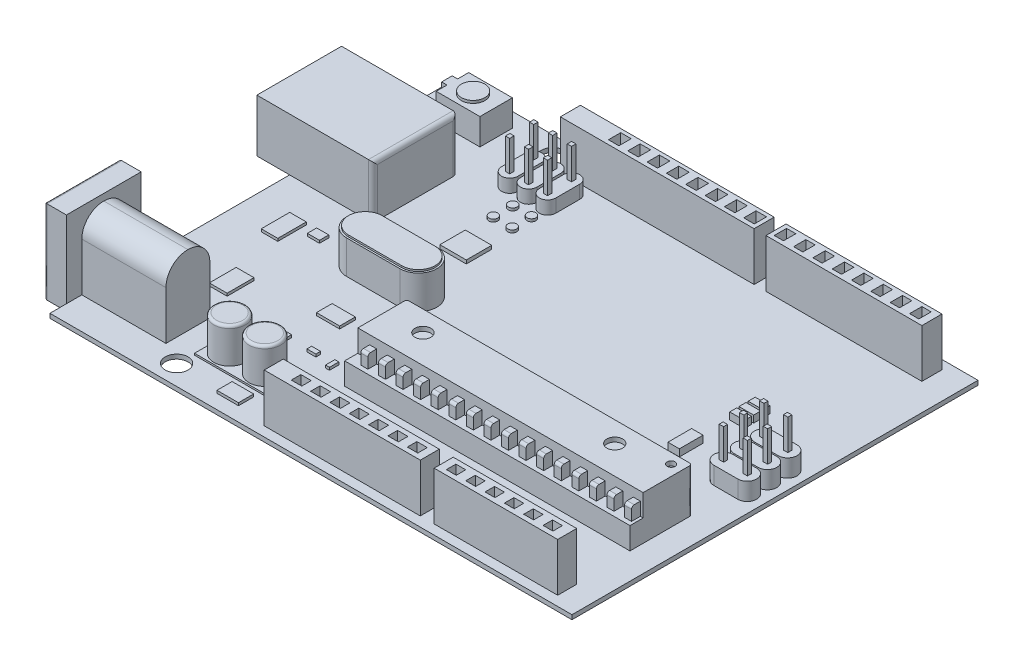
from build123d import *

# Parameters (mm, degrees)
BOSS_EXTRUDE2_DEPTH    = 55
SKETCH3_W              = 140.514955922
SKETCH3_H              = 21.639303212
BOSS_EXTRUDE3_DEPTH    = 55
CUT_EXTRUDE1_START     = 5
SKETCH4_W              = 11.850658933
SKETCH4_H              = 10.834888168
SKETCH4_W_2            = 11.204003532
CUT_EXTRUDE1_DEPTH     = 50
SKETCH5_W              = 220.455310393
SKETCH5_H              = 22.830323406
BOSS_EXTRUDE4_DEPTH    = 55
SKETCH6_W              = 177.429354246
SKETCH6_H              = 22.830323406
BOSS_EXTRUDE5_DEPTH    = 55
CUT_EXTRUDE2_START     = 5
SKETCH7_W              = 11.936344285
SKETCH7_H              = 14.002250028
SKETCH7_W_2            = 10.5429453
CUT_EXTRUDE2_DEPTH     = 50
SKETCH8_W              = 324.618660934
SKETCH8_H              = 70.631313038
BOSS_EXTRUDE6_DEPTH    = 25
SKETCH9_W              = 324.618660934
SKETCH9_H              = 55.631313038
BOSS_EXTRUDE7_DEPTH    = 25
FILLET1_R              = 3
FILLET2_R              = 3
SKETCH10_W             = 8
SKETCH10_H             = 15
BOSS_EXTRUDE8_DEPTH    = 10
FILLET3_R              = 3
LPATTERN1_COUNT        = 16
LPATTERN1_PITCH        = 20
FILLET3_OF_LPATTERN1_R = 3
SKETCH11_R             = 9
SKETCH11_R_2           = 4.513225895
CUT_EXTRUDE3_DEPTH     = 5
BOSS_EXTRUDE9_DEPTH    = 20
BOSS_EXTRUDE9_2_DEPTH  = 20
BOSS_EXTRUDE9_3_DEPTH  = 20
SKETCH13_W             = 5
SKETCH13_H             = 4.487343
BOSS_EXTRUDE10_DEPTH   = 35
SKETCH14_W             = 13.054082129
SKETCH14_H             = 26.924044392
BOSS_EXTRUDE11_DEPTH   = 8
SKETCH15_W             = 16.725542728
SKETCH15_H             = 8
BOSS_EXTRUDE12_DEPTH   = 8
BOSS_EXTRUDE12_2_DEPTH = 8
BOSS_EXTRUDE12_3_DEPTH = 8
BOSS_EXTRUDE13_DEPTH   = 15
BOSS_EXTRUDE13_2_DEPTH = 15
BOSS_EXTRUDE13_3_DEPTH = 15
SKETCH17_W             = 4.794005122
SKETCH17_H             = 5
BOSS_EXTRUDE14_DEPTH   = 35
SKETCH18_R             = 5
BOSS_EXTRUDE15_DEPTH   = 3
BOSS_EXTRUDE15_2_DEPTH = 3
SKETCH19_R             = 5
BOSS_EXTRUDE16_DEPTH   = 3
BOSS_EXTRUDE16_2_DEPTH = 3
SKETCH20_W             = 30.070200568
SKETCH20_H             = 28.94608092
BOSS_EXTRUDE17_DEPTH   = 4
BOSS_EXTRUDE18_DEPTH   = 38
BOSS_EXTRUDE19_DEPTH   = 2
SKETCH23_W             = 26.397561438
SKETCH23_H             = 17.836190161
BOSS_EXTRUDE20_DEPTH   = 3
SKETCH24_W             = 8.430897355
SKETCH24_H             = 10.67913665
BOSS_EXTRUDE21_DEPTH   = 3
SKETCH24_W_2           = 10.117076826
SKETCH24_H_2           = 5.339568325
BOSS_EXTRUDE21_2_DEPTH = 3
SKETCH24_W_3           = 4.49647859
BOSS_EXTRUDE21_3_DEPTH = 3
SKETCH25_W             = 80
SKETCH25_H             = 39.903369736
BOSS_EXTRUDE22_DEPTH   = 2
SKETCH26_R             = 18
BOSS_EXTRUDE23_DEPTH   = 40
FILLET4_R              = 3
SKETCH27_W             = 24.491756817
SKETCH27_H             = 17.260857185
BOSS_EXTRUDE24_DEPTH   = 3
SKETCH28_W             = 131.987807193
SKETCH28_H             = 96.315426871
BOSS_EXTRUDE25_DEPTH   = 60
CUT_EXTRUDE4_DEPTH     = 80
SKETCH30_W             = 40.013805294
SKETCH30_H             = 14.419389296
BOSS_EXTRUDE26_DEPTH   = 80
FILLET5_R              = 5
BOSS_EXTRUDE27_DEPTH   = 30
SKETCH32_R             = 13.354909124
BOSS_EXTRUDE28_DEPTH   = 3
SKETCH33_W             = 95.708096648
SKETCH33_H             = 50
BOSS_EXTRUDE29_DEPTH   = 80
SKETCH34_W             = 85
SKETCH34_H             = 95
BOSS_EXTRUDE30_DEPTH   = 25
FILLET6_R              = 25
SKETCH35_R             = 21.697959762
CUT_EXTRUDE5_DEPTH     = 97
FILLET7_R              = 3
SKETCH36_W             = 18.831629025
SKETCH36_H             = 32.390401922
BOSS_EXTRUDE31_DEPTH   = 3
SKETCH36_W_2           = 13.782631251
SKETCH36_H_2           = 10.600232663
BOSS_EXTRUDE31_2_DEPTH = 3
SKETCH37_W             = 20.243239651
SKETCH37_H             = 30.580213089
BOSS_EXTRUDE32_DEPTH   = 3
SKETCH39_W             = 594
SKETCH39_H             = 462
BOSS_EXTRUDE33_DEPTH   = 5
SKETCH38_R             = 13.537031913
SKETCH38_R_2           = 12.986709959
CUT_EXTRUDE6_DEPTH     = 758.585803721


with BuildPart() as part:
    # Sketch2 → Boss-Extrude2 (new body)
    with BuildSketch(Plane(origin=(0, 100, 0), x_dir=(1, 0, 0), z_dir=(0, 1, 0))):
        Polygon((406.248513128, 32.646926651), (410.39103989, 32.646926651), (410.39103989, 11.007623439), (406.248513128, 11.007623439), (232.853057519, 11.007623439), (232.853057519, 32.646926651), align=None)
    extrude(amount=BOSS_EXTRUDE2_DEPTH)


with BuildPart() as body_2:
    # Sketch3 → Boss-Extrude3 (new body)
    with BuildSketch(Plane(origin=(0, 100, 0), x_dir=(1, 0, 0), z_dir=(0, 1, 0))):
        with Locations((496.46809161, 21.827275045)):
            Rectangle(SKETCH3_W, SKETCH3_H)
    extrude(amount=BOSS_EXTRUDE3_DEPTH)


with BuildPart() as cut_extrude1_tool:
    # Sketch4 → Cut-Extrude1 (new body)
    with BuildSketch(Plane(origin=(0, 100, 0), x_dir=(1, 0, 0), z_dir=(0, 1, 0)).offset(CUT_EXTRUDE1_START)):
        with Locations((264.057662434, 21.953706004)):
            Rectangle(SKETCH4_W, SKETCH4_H)
        with Locations((286.057662434, 21.953706004)):
            Rectangle(SKETCH4_W, SKETCH4_H)
        with Locations((308.057662434, 21.953706004)):
            Rectangle(SKETCH4_W, SKETCH4_H)
        with Locations((330.057662434, 21.953706004)):
            Rectangle(SKETCH4_W, SKETCH4_H)
        with Locations((352.057662434, 21.953706004)):
            Rectangle(SKETCH4_W, SKETCH4_H)
        with Locations((374.057662434, 21.953706004)):
            Rectangle(SKETCH4_W, SKETCH4_H)
        with Locations((396.057662434, 21.953706004)):
            Rectangle(SKETCH4_W, SKETCH4_H)
        with Locations((440.192463475, 21.953706004)):
            Rectangle(SKETCH4_W_2, SKETCH4_H)
        with Locations((462.192463475, 21.953706004)):
            Rectangle(SKETCH4_W_2, SKETCH4_H)
        with Locations((484.192463475, 21.953706004)):
            Rectangle(SKETCH4_W_2, SKETCH4_H)
        with Locations((506.192463475, 21.953706004)):
            Rectangle(SKETCH4_W_2, SKETCH4_H)
        with Locations((528.192463475, 21.953706004)):
            Rectangle(SKETCH4_W_2, SKETCH4_H)
        with Locations((550.192463475, 21.953706004)):
            Rectangle(SKETCH4_W_2, SKETCH4_H)
    extrude(amount=CUT_EXTRUDE1_DEPTH)


with BuildPart() as part_1:
    add(part.part)

    # Cut-Extrude1: cut by cut_extrude1_tool
    add(cut_extrude1_tool.part, mode=Mode.SUBTRACT)



with BuildPart() as body_2_1:
    add(body_2.part)

    # Cut-Extrude1: cut by cut_extrude1_tool
    add(cut_extrude1_tool.part, mode=Mode.SUBTRACT)


with BuildPart() as body_3:
    # Sketch5 → Boss-Extrude4 (new body)
    with BuildSketch(Plane(origin=(0, 100, 0), x_dir=(1, 0, 0), z_dir=(0, 1, 0))):
        with Locations((262.041067284, 440.396872493)):
            Rectangle(SKETCH5_W, SKETCH5_H)
    extrude(amount=BOSS_EXTRUDE4_DEPTH)


with BuildPart() as body_4:
    # Sketch6 → Boss-Extrude5 (new body)
    with BuildSketch(Plane(origin=(0, 100, 0), x_dir=(1, 0, 0), z_dir=(0, 1, 0))):
        with Locations((474.456716745, 440.396872493)):
            Rectangle(SKETCH6_W, SKETCH6_H)
    extrude(amount=BOSS_EXTRUDE5_DEPTH)


with BuildPart() as cut_extrude2_tool:
    # Sketch7 → Cut-Extrude2 (new body)
    with BuildSketch(Plane(origin=(0, 100, 0), x_dir=(1, 0, 0), z_dir=(0, 1, 0)).offset(CUT_EXTRUDE2_START)):
        with Locations((207.691240249, 440.745978972)):
            Rectangle(SKETCH7_W, SKETCH7_H)
        with Locations((229.691240249, 440.745978972)):
            Rectangle(SKETCH7_W, SKETCH7_H)
        with Locations((251.691240249, 440.745978972)):
            Rectangle(SKETCH7_W, SKETCH7_H)
        with Locations((273.691240248, 440.745978972)):
            Rectangle(SKETCH7_W, SKETCH7_H)
        with Locations((295.691240249, 440.745978972)):
            Rectangle(SKETCH7_W, SKETCH7_H)
        with Locations((317.691240249, 440.745978972)):
            Rectangle(SKETCH7_W, SKETCH7_H)
        with Locations((339.691240249, 440.745978972)):
            Rectangle(SKETCH7_W, SKETCH7_H)
        with Locations((361.691240249, 440.745978972)):
            Rectangle(SKETCH7_W, SKETCH7_H)
        with Locations((395.678951184, 440.745978972)):
            Rectangle(SKETCH7_W_2, SKETCH7_H)
        with Locations((417.678951184, 440.745978972)):
            Rectangle(SKETCH7_W_2, SKETCH7_H)
        with Locations((439.678951184, 440.745978972)):
            Rectangle(SKETCH7_W_2, SKETCH7_H)
        with Locations((461.678951184, 440.745978972)):
            Rectangle(SKETCH7_W_2, SKETCH7_H)
        with Locations((483.678951184, 440.745978972)):
            Rectangle(SKETCH7_W_2, SKETCH7_H)
        with Locations((505.678951184, 440.745978972)):
            Rectangle(SKETCH7_W_2, SKETCH7_H)
        with Locations((527.678951184, 440.745978972)):
            Rectangle(SKETCH7_W_2, SKETCH7_H)
        with Locations((549.678951184, 440.745978972)):
            Rectangle(SKETCH7_W_2, SKETCH7_H)
    extrude(amount=CUT_EXTRUDE2_DEPTH)


with BuildPart() as body_3_1:
    add(body_3.part)

    # Cut-Extrude2: cut by cut_extrude2_tool
    add(cut_extrude2_tool.part, mode=Mode.SUBTRACT)


with BuildPart() as body_4_1:
    add(body_4.part)

    # Cut-Extrude2: cut by cut_extrude2_tool
    add(cut_extrude2_tool.part, mode=Mode.SUBTRACT)


with BuildPart() as body_5:
    # Sketch8 → Boss-Extrude6 (new body)
    with BuildSketch(Plane(origin=(0, 100, 0), x_dir=(1, 0, 0), z_dir=(0, 1, 0))):
        with Locations((401.876798148, 131.117335097)):
            Rectangle(SKETCH8_W, SKETCH8_H)
    extrude(amount=BOSS_EXTRUDE6_DEPTH)

    # Sketch9 → Boss-Extrude7 (add)
    with BuildSketch(Plane(origin=(0, 125, 0), x_dir=(1, 0, 0), z_dir=(0, 1, 0))):
        with Locations((401.876798148, 138.617335097)):
            Rectangle(SKETCH9_W, SKETCH9_H)
    extrude(amount=BOSS_EXTRUDE7_DEPTH)

    # Fillet1
    fillet1_edges = [body_5.edges().sort_by_distance(p)[0] for p in [
        (239.567467681, 125, -166.432991616),
    ]]
    fillet(fillet1_edges, radius=FILLET1_R)

    # Fillet2
    fillet2_edges = [body_5.edges().sort_by_distance(p)[0] for p in [
        (564.186128615, 125, -166.432991616),
    ]]
    fillet(fillet2_edges, radius=FILLET2_R)

    # Sketch10 → Boss-Extrude8 (add)
    with BuildSketch(Plane.XY.offset(-110.801678578)):
        with Locations((257.009389887, 132.5)):
            Rectangle(SKETCH10_W, SKETCH10_H)
    boss_extrude8 = extrude(amount=BOSS_EXTRUDE8_DEPTH)

    # Fillet3
    fillet3_edges = [body_5.edges().sort_by_distance(p)[0] for p in [
        (257.009389887, 140, -100.801678578),
    ]]
    fillet(fillet3_edges, radius=FILLET3_R)

    # LPattern1: Boss-Extrude8 ×16
    with Locations(*[(i * LPATTERN1_PITCH, 0, 0) for i in range(1, LPATTERN1_COUNT)]):
        add(boss_extrude8)

    # Fillet3 of LPattern1
    fillet3_of_lpattern1_edges = [body_5.edges().sort_by_distance(p)[0] for p in [
        (277.009389887, 140, -100.801678578),
        (297.009389887, 140, -100.801678578),
        (317.009389887, 140, -100.801678578),
        (337.009389887, 140, -100.801678578),
        (357.009389887, 140, -100.801678578),
        (377.009389887, 140, -100.801678578),
        (397.009389887, 140, -100.801678578),
        (417.009389887, 140, -100.801678578),
        (437.009389887, 140, -100.801678578),
        (457.009389887, 140, -100.801678578),
        (477.009389887, 140, -100.801678578),
        (497.009389887, 140, -100.801678578),
        (517.009389887, 140, -100.801678578),
        (537.009389887, 140, -100.801678578),
        (557.009389887, 140, -100.801678578),
    ]]
    fillet(fillet3_of_lpattern1_edges, radius=FILLET3_OF_LPATTERN1_R)

    # Sketch11 → Cut-Extrude3 (cut)
    with BuildSketch(Plane(origin=(0, 150, 0), x_dir=(1, 0, 0), z_dir=(0, 1, 0))):
        with Locations(Location((281.372940119, 143.017085272, 0), (0, 0, 270))):
            Circle(SKETCH11_R)
        with Locations(Location((499.66166973, 143.017085272, 0), (0, 0, 270))):
            Circle(SKETCH11_R)
        with Locations(Location((552.041174275, 154.806553195, 0), (0, 0, 270))):
            Circle(SKETCH11_R_2)
    extrude(amount=-CUT_EXTRUDE3_DEPTH, mode=Mode.SUBTRACT)


with BuildPart() as body_6:
    # Sketch12 → Boss-Extrude9 (new body)
    with BuildSketch(Plane(origin=(0, 100, 0), x_dir=(1, 0, 0), z_dir=(0, 1, 0))):
        with BuildLine():
            Line((547.517549409, 275.451253059), (574.628558454, 275.451253059))
            ThreePointArc((574.628558454, 275.451253059), (585.330272551, 264.749538962), (574.628558454, 254.047824865))
            Line((574.628558454, 254.047824865), (547.517549409, 254.047824865))
            ThreePointArc((547.517549409, 254.047824865), (536.815835312, 264.749538962), (547.517549409, 275.451253059))
        make_face()
    extrude(amount=BOSS_EXTRUDE9_DEPTH)



with BuildPart() as body_7:
    # Sketch12 → Boss-Extrude9 2 (new body)
    with BuildSketch(Plane(origin=(0, 100, 0), x_dir=(1, 0, 0), z_dir=(0, 1, 0))):
        with BuildLine():
            Line((547.517549409, 252.451253059), (574.628558454, 252.451253059))
            ThreePointArc((574.628558454, 252.451253059), (585.330272551, 241.749538962), (574.628558454, 231.047824865))
            Line((574.628558454, 231.047824865), (547.517549409, 231.047824865))
            ThreePointArc((547.517549409, 231.047824865), (536.815835312, 241.749538962), (547.517549409, 252.451253059))
        make_face()
    extrude(amount=BOSS_EXTRUDE9_2_DEPTH)


with BuildPart() as body_8:
    # Sketch12 → Boss-Extrude9 3 (new body)
    with BuildSketch(Plane(origin=(0, 100, 0), x_dir=(1, 0, 0), z_dir=(0, 1, 0))):
        with BuildLine():
            Line((547.517549409, 229.451253059), (574.628558454, 229.451253059))
            ThreePointArc((574.628558454, 229.451253059), (585.330272551, 218.749538962), (574.628558454, 208.047824865))
            Line((574.628558454, 208.047824865), (547.517549409, 208.047824865))
            ThreePointArc((547.517549409, 208.047824865), (536.815835312, 218.749538962), (547.517549409, 229.451253059))
        make_face()
    extrude(amount=BOSS_EXTRUDE9_3_DEPTH)


with BuildPart() as body_6_1:
    add(body_6.part)

    add(body_7.part)  # Boss-Extrude10 merges body 7

    add(body_8.part)  # Boss-Extrude10 merges body 8
    # Sketch13 → Boss-Extrude10 (add)
    with BuildSketch(Plane(origin=(0, 120, 0), x_dir=(1, 0, 0), z_dir=(0, 1, 0))):
        with Locations((547.517549409, 241.749538962)):
            Rectangle(SKETCH13_W, SKETCH13_H)
        with Locations((547.517549409, 264.749538962)):
            Rectangle(SKETCH13_W, SKETCH13_H)
        with Locations((574.628558454, 264.749538962)):
            Rectangle(SKETCH13_W, SKETCH13_H)
        with Locations((574.628558454, 241.749538962)):
            Rectangle(SKETCH13_W, SKETCH13_H)
        with Locations((547.517549409, 218.749538962)):
            Rectangle(SKETCH13_W, SKETCH13_H)
        with Locations((574.628558454, 218.749538962)):
            Rectangle(SKETCH13_W, SKETCH13_H)
    extrude(amount=BOSS_EXTRUDE10_DEPTH)


with BuildPart() as body_7_2:
    # Sketch14 → Boss-Extrude11 (new body)
    with BuildSketch(Plane(origin=(0, 100, 0), x_dir=(1, 0, 0), z_dir=(0, 1, 0))):
        with Locations((493.129270674, 230.042416205)):
            Rectangle(SKETCH14_W, SKETCH14_H)
    extrude(amount=BOSS_EXTRUDE11_DEPTH)


with BuildPart() as body_8_2:
    # Sketch15 → Boss-Extrude12 (new body)
    with BuildSketch(Plane(origin=(0, 100, 0), x_dir=(1, 0, 0), z_dir=(0, 1, 0))):
        with Locations((500.268221838, 306.602608522)):
            Rectangle(SKETCH15_W, SKETCH15_H)
    extrude(amount=BOSS_EXTRUDE12_DEPTH)


with BuildPart() as body_9:
    # Sketch15 → Boss-Extrude12 2 (new body)
    with BuildSketch(Plane(origin=(0, 100, 0), x_dir=(1, 0, 0), z_dir=(0, 1, 0))):
        with Locations((500.268221838, 296.102608522)):
            Rectangle(SKETCH15_W, SKETCH15_H)
    extrude(amount=BOSS_EXTRUDE12_2_DEPTH)


with BuildPart() as body_10:
    # Sketch15 → Boss-Extrude12 3 (new body)
    with BuildSketch(Plane(origin=(0, 100, 0), x_dir=(1, 0, 0), z_dir=(0, 1, 0))):
        with Locations((500.268221838, 285.602608522)):
            Rectangle(SKETCH15_W, SKETCH15_H)
    extrude(amount=BOSS_EXTRUDE12_3_DEPTH)


with BuildPart() as body_11:
    # Sketch16 → Boss-Extrude13 (new body)
    with BuildSketch(Plane(origin=(0, 100, 0), x_dir=(1, 0, 0), z_dir=(0, 1, 0))):
        with BuildLine():
            Line((146.171960946, 413.685173852), (146.171960946, 386.394359112))
            ThreePointArc((146.171960946, 386.394359112), (136.841767873, 377.064166039), (127.511574799, 386.394359112))
            Line((127.511574799, 386.394359112), (127.511574799, 413.685173852))
            ThreePointArc((127.511574799, 413.685173852), (136.841767873, 423.015366925), (146.171960946, 413.685173852))
        make_face()
    extrude(amount=BOSS_EXTRUDE13_DEPTH)



with BuildPart() as body_12:
    # Sketch16 → Boss-Extrude13 2 (new body)
    with BuildSketch(Plane(origin=(0, 100, 0), x_dir=(1, 0, 0), z_dir=(0, 1, 0))):
        with BuildLine():
            Line((167.671960946, 413.685173852), (167.671960946, 386.394359112))
            ThreePointArc((167.671960946, 386.394359112), (158.341767873, 377.064166039), (149.011574799, 386.394359112))
            Line((149.011574799, 386.394359112), (149.011574799, 413.685173852))
            ThreePointArc((149.011574799, 413.685173852), (158.341767873, 423.015366925), (167.671960946, 413.685173852))
        make_face()
    extrude(amount=BOSS_EXTRUDE13_2_DEPTH)


with BuildPart() as body_13:
    # Sketch16 → Boss-Extrude13 3 (new body)
    with BuildSketch(Plane(origin=(0, 100, 0), x_dir=(1, 0, 0), z_dir=(0, 1, 0))):
        with BuildLine():
            Line((189.171960946, 413.685173852), (189.171960946, 386.394359112))
            ThreePointArc((189.171960946, 386.394359112), (179.841767873, 377.064166039), (170.511574799, 386.394359112))
            Line((170.511574799, 386.394359112), (170.511574799, 413.685173852))
            ThreePointArc((170.511574799, 413.685173852), (179.841767873, 423.015366925), (189.171960946, 413.685173852))
        make_face()
    extrude(amount=BOSS_EXTRUDE13_3_DEPTH)


with BuildPart() as body_11_1:
    add(body_11.part)

    add(body_12.part)  # Boss-Extrude14 merges body 12

    add(body_13.part)  # Boss-Extrude14 merges body 13
    # Sketch17 → Boss-Extrude14 (add)
    with BuildSketch(Plane(origin=(0, 115, 0), x_dir=(1, 0, 0), z_dir=(0, 1, 0))):
        with Locations((158.341767873, 386.394359112)):
            Rectangle(SKETCH17_W, SKETCH17_H)
        with Locations((136.841767873, 413.685173852)):
            Rectangle(SKETCH17_W, SKETCH17_H)
        with Locations((136.841767873, 386.394359112)):
            Rectangle(SKETCH17_W, SKETCH17_H)
        with Locations((158.341767873, 413.685173852)):
            Rectangle(SKETCH17_W, SKETCH17_H)
        with Locations((179.841767873, 386.394359112)):
            Rectangle(SKETCH17_W, SKETCH17_H)
        with Locations((179.841767873, 413.685173852)):
            Rectangle(SKETCH17_W, SKETCH17_H)
    extrude(amount=BOSS_EXTRUDE14_DEPTH)


with BuildPart() as body_12_2:
    # Sketch18 → Boss-Extrude15 (new body)
    with BuildSketch(Plane(origin=(0, 100, 0), x_dir=(1, 0, 0), z_dir=(0, 1, 0))):
        with Locations(Location((159.014308683, 367.570995224, 0), (0, 0, 270))):
            Circle(SKETCH18_R)
    extrude(amount=BOSS_EXTRUDE15_DEPTH)


with BuildPart() as body_13_2:
    # Sketch18 → Boss-Extrude15 2 (new body)
    with BuildSketch(Plane(origin=(0, 100, 0), x_dir=(1, 0, 0), z_dir=(0, 1, 0))):
        with Locations(Location((180.310474373, 367.570995224, 0), (0, 0, 270))):
            Circle(SKETCH18_R)
    extrude(amount=BOSS_EXTRUDE15_2_DEPTH)


with BuildPart() as body_14:
    # Sketch19 → Boss-Extrude16 (new body)
    with BuildSketch(Plane(origin=(0, 100, 0), x_dir=(1, 0, 0), z_dir=(0, 1, 0))):
        with Locations(Location((158.910816745, 345.61565714, 0), (0, 0, 270))):
            Circle(SKETCH19_R)
    extrude(amount=BOSS_EXTRUDE16_DEPTH)


with BuildPart() as body_15:
    # Sketch19 → Boss-Extrude16 2 (new body)
    with BuildSketch(Plane(origin=(0, 100, 0), x_dir=(1, 0, 0), z_dir=(0, 1, 0))):
        with Locations(Location((180.400583941, 345.61565714, 0), (0, 0, 270))):
            Circle(SKETCH19_R)
    extrude(amount=BOSS_EXTRUDE16_2_DEPTH)


with BuildPart() as body_16:
    # Sketch20 → Boss-Extrude17 (new body)
    with BuildSketch(Plane(origin=(0, 100, 0), x_dir=(1, 0, 0), z_dir=(0, 1, 0))):
        with Locations((173.285663949, 299.908366785)):
            Rectangle(SKETCH20_W, SKETCH20_H)
    extrude(amount=BOSS_EXTRUDE17_DEPTH)


with BuildPart() as body_17:
    # Sketch21 → Boss-Extrude18 (new body)
    with BuildSketch(Plane(origin=(0, 100, 0), x_dir=(1, 0, 0), z_dir=(0, 1, 0))):
        with BuildLine():
            Line((132.676841687, 247.215258314), (193.098272734, 247.215258314))
            ThreePointArc((193.098272734, 247.215258314), (214.175516123, 226.138014926), (193.098272734, 205.060771537))
            Line((193.098272734, 205.060771537), (132.676841687, 205.060771537))
            ThreePointArc((132.676841687, 205.060771537), (111.599598299, 226.138014926), (132.676841687, 247.215258314))
        make_face()
    extrude(amount=BOSS_EXTRUDE18_DEPTH)

    # Sketch22 → Boss-Extrude19 (add)
    with BuildSketch(Plane(origin=(0, 138, 0), x_dir=(1, 0, 0), z_dir=(0, 1, 0))):
        with BuildLine():
            Line((132.676841687, 207.060771537), (193.098272734, 207.060771537))
            ThreePointArc((193.098272734, 207.060771537), (212.175516123, 226.138014926), (193.098272734, 245.215258314))
            Line((193.098272734, 245.215258314), (132.676841687, 245.215258314))
            ThreePointArc((132.676841687, 245.215258314), (113.599598299, 226.138014926), (132.676841687, 207.060771537))
        make_face()
    extrude(amount=BOSS_EXTRUDE19_DEPTH)


with BuildPart() as body_18:
    # Sketch23 → Boss-Extrude20 (new body)
    with BuildSketch(Plane(origin=(0, 100, 0), x_dir=(1, 0, 0), z_dir=(0, 1, 0))):
        with Locations((167.152535626, 158.228344143)):
            Rectangle(SKETCH23_W, SKETCH23_H)
    extrude(amount=BOSS_EXTRUDE20_DEPTH)


with BuildPart() as body_19:
    # Sketch24 → Boss-Extrude21 (new body)
    with BuildSketch(Plane(origin=(0, 100, 0), x_dir=(1, 0, 0), z_dir=(0, 1, 0))):
        with Locations((157.358825507, 108.14372549)):
            Rectangle(SKETCH24_W, SKETCH24_H)
    extrude(amount=BOSS_EXTRUDE21_DEPTH)


with BuildPart() as body_20:
    # Sketch24 → Boss-Extrude21 2 (new body)
    with BuildSketch(Plane(origin=(0, 100, 0), x_dir=(1, 0, 0), z_dir=(0, 1, 0))):
        with Locations((189.396235457, 110.813509653)):
            Rectangle(SKETCH24_W_2, SKETCH24_H_2)
    extrude(amount=BOSS_EXTRUDE21_2_DEPTH)


with BuildPart() as body_21:
    # Sketch24 → Boss-Extrude21 3 (new body)
    with BuildSketch(Plane(origin=(0, 100, 0), x_dir=(1, 0, 0), z_dir=(0, 1, 0))):
        with Locations((213.002748052, 108.14372549)):
            Rectangle(SKETCH24_W_3, SKETCH24_H)
    extrude(amount=BOSS_EXTRUDE21_3_DEPTH)


with BuildPart() as body_22:
    # Sketch25 → Boss-Extrude22 (new body)
    with BuildSketch(Plane(origin=(0, 100, 0), x_dir=(1, 0, 0), z_dir=(0, 1, 0))):
        with Locations((163.627815401, 60.874256451)):
            Rectangle(SKETCH25_W, SKETCH25_H)
    extrude(amount=BOSS_EXTRUDE22_DEPTH)

    # Sketch26 → Boss-Extrude23 (add)
    with BuildSketch(Plane(origin=(0, 102, 0), x_dir=(1, 0, 0), z_dir=(0, 1, 0))):
        with Locations(Location((143.627815401, 60.874256451, 0), (0, 0, 270))):
            Circle(SKETCH26_R)
        with Locations(Location((183.627815401, 60.874256451, 0), (0, 0, 270))):
            Circle(SKETCH26_R)
    extrude(amount=BOSS_EXTRUDE23_DEPTH)

    # Fillet4
    fillet4_edges = [body_22.edges().sort_by_distance(p)[0] for p in [
        (143.627815401, 142, -78.874256451),
        (183.627815401, 142, -78.874256451),
    ]]
    fillet(fillet4_edges, radius=FILLET4_R)


with BuildPart() as body_23:
    # Sketch27 → Boss-Extrude24 (new body)
    with BuildSketch(Plane(origin=(0, 100, 0), x_dir=(1, 0, 0), z_dir=(0, 1, 0))):
        with Locations((186.138192793, 24.786610899)):
            Rectangle(SKETCH27_W, SKETCH27_H)
    extrude(amount=BOSS_EXTRUDE24_DEPTH)


with BuildPart() as body_24:
    # Sketch28 → Boss-Extrude25 (new body)
    with BuildSketch(Plane(origin=(0, 100, 0), x_dir=(1, 0, 0), z_dir=(0, 1, 0))):
        with Locations((28.743699975, 320.894398413)):
            Rectangle(SKETCH28_W, SKETCH28_H)
    extrude(amount=BOSS_EXTRUDE25_DEPTH)

    # Sketch29 → Cut-Extrude4 (cut)
    with BuildSketch(Plane.ZY.offset(37.250203622)):
        Polygon((-359.052111848, 143.624210904), (-341.052111848, 150.165159017), (-300.736684977, 150.165159017), (-282.736684977, 143.624210904), (-282.736684977, 110), (-359.052111848, 110), align=None)
    extrude(amount=-CUT_EXTRUDE4_DEPTH, mode=Mode.SUBTRACT)

    # Sketch30 → Boss-Extrude26 (add)
    with BuildSketch(Plane.ZY.offset(-42.749796378)):
        with Locations((-322.95109062, 129.095180551)):
            Rectangle(SKETCH30_W, SKETCH30_H)
    extrude(amount=BOSS_EXTRUDE26_DEPTH)

    # Fillet5
    fillet5_edges = [body_24.edges().sort_by_distance(p)[0] for p in [
        (94.737603571, 160, -320.894398413),
        (-37.250203622, 126.812105452, -359.052111848),
        (-37.250203622, 126.812105452, -282.736684977),
        (94.737603571, 130, -369.052111848),
        (94.737603571, 130, -272.736684977),
    ]]
    fillet(fillet5_edges, radius=FILLET5_R)


with BuildPart() as body_25:
    # Sketch31 → Boss-Extrude27 (new body)
    with BuildSketch(Plane(origin=(0, 100, 0), x_dir=(1, 0, 0), z_dir=(0, 1, 0))):
        Polygon((31.007410333, 445.458661852), (80.754514515, 445.458661852), (80.754514515, 408.517742905), (31.007410333, 408.517742905), (31.007410333, 420.831382554), (24.850590509, 420.831382554), (24.850590509, 432.89874941), (31.007410333, 432.89874941), align=None)
    extrude(amount=BOSS_EXTRUDE27_DEPTH)

    # Sketch32 → Boss-Extrude28 (add)
    with BuildSketch(Plane(origin=(0, 130, 0), x_dir=(1, 0, 0), z_dir=(0, 1, 0))):
        with Locations(Location((54.578507847, 426.988202379, 0), (0, 0, 270))):
            Circle(SKETCH32_R)
    extrude(amount=BOSS_EXTRUDE28_DEPTH)


with BuildPart() as body_26:
    # Sketch33 → Boss-Extrude29 (new body)
    with BuildSketch(Plane(origin=(0, 100, 0), x_dir=(1, 0, 0), z_dir=(0, 1, 0))):
        with Locations((47.854048324, 61.280955883)):
            Rectangle(SKETCH33_W, SKETCH33_H)
    extrude(amount=BOSS_EXTRUDE29_DEPTH)

    # Sketch34 → Boss-Extrude30 (add)
    with BuildSketch(Plane.ZY):
        with Locations((-61.280955883, 140)):
            Rectangle(SKETCH34_W, SKETCH34_H)
    extrude(amount=BOSS_EXTRUDE30_DEPTH)

    # Fillet6
    fillet6_edges = [body_26.edges().sort_by_distance(p)[0] for p in [
        (47.854048324, 180, -86.280955883),
        (47.854048324, 180, -36.280955883),
    ]]
    fillet(fillet6_edges, radius=FILLET6_R - 0.0001)  # a hair under: the kernel refuses the full size

    # Sketch35 → Cut-Extrude5 (cut)
    with BuildSketch(Plane.ZY.offset(25)):
        with Locations((-61.280955883, 139.184137816)):
            Circle(SKETCH35_R)
    extrude(amount=-CUT_EXTRUDE5_DEPTH, mode=Mode.SUBTRACT)

    # Fillet7
    fillet7_edges = [body_26.edges().sort_by_distance(p)[0] for p in [
        (-25, 140, -18.780955883),
        (-25, 187.5, -61.280955883),
        (-25, 140, -103.780955883),
        (-25, 92.5, -61.280955883),
    ]]
    fillet(fillet7_edges, radius=FILLET7_R)


with BuildPart() as body_27:
    # Sketch36 → Boss-Extrude31 (new body)
    with BuildSketch(Plane(origin=(0, 100, 0), x_dir=(1, 0, 0), z_dir=(0, 1, 0))):
        with Locations((49.382289247, 216.687961941)):
            Rectangle(SKETCH36_W, SKETCH36_H)
    extrude(amount=BOSS_EXTRUDE31_DEPTH)


with BuildPart() as body_28:
    # Sketch36 → Boss-Extrude31 2 (new body)
    with BuildSketch(Plane(origin=(0, 100, 0), x_dir=(1, 0, 0), z_dir=(0, 1, 0))):
        with Locations((77.524764738, 227.583046571)):
            Rectangle(SKETCH36_W_2, SKETCH36_H_2)
    extrude(amount=BOSS_EXTRUDE31_2_DEPTH)


with BuildPart() as body_29:
    # Sketch37 → Boss-Extrude32 (new body)
    with BuildSketch(Plane(origin=(0, 100, 0), x_dir=(1, 0, 0), z_dir=(0, 1, 0))):
        with Locations((73.863753312, 132.911180718)):
            Rectangle(SKETCH37_W, SKETCH37_H)
    extrude(amount=BOSS_EXTRUDE32_DEPTH)


with BuildPart() as part_2:
    add(part_1.part)

    add(body_2_1.part)  # Boss-Extrude33 merges body 2

    add(body_3_1.part)  # Boss-Extrude33 merges body 3

    add(body_4_1.part)  # Boss-Extrude33 merges body 4

    add(body_5.part)  # Boss-Extrude33 merges body 5

    add(body_6_1.part)  # Boss-Extrude33 merges body 6

    add(body_7_2.part)  # Boss-Extrude33 merges body 7 2

    add(body_8_2.part)  # Boss-Extrude33 merges body 8 2

    add(body_9.part)  # Boss-Extrude33 merges body 9

    add(body_10.part)  # Boss-Extrude33 merges body 10

    add(body_11_1.part)  # Boss-Extrude33 merges body 11

    add(body_12_2.part)  # Boss-Extrude33 merges body 12 2

    add(body_13_2.part)  # Boss-Extrude33 merges body 13 2

    add(body_14.part)  # Boss-Extrude33 merges body 14

    add(body_15.part)  # Boss-Extrude33 merges body 15

    add(body_16.part)  # Boss-Extrude33 merges body 16

    add(body_17.part)  # Boss-Extrude33 merges body 17

    add(body_18.part)  # Boss-Extrude33 merges body 18

    add(body_19.part)  # Boss-Extrude33 merges body 19

    add(body_20.part)  # Boss-Extrude33 merges body 20

    add(body_21.part)  # Boss-Extrude33 merges body 21

    add(body_22.part)  # Boss-Extrude33 merges body 22

    add(body_23.part)  # Boss-Extrude33 merges body 23

    add(body_24.part)  # Boss-Extrude33 merges body 24

    add(body_25.part)  # Boss-Extrude33 merges body 25

    add(body_26.part)  # Boss-Extrude33 merges body 26

    add(body_27.part)  # Boss-Extrude33 merges body 27

    add(body_28.part)  # Boss-Extrude33 merges body 28

    add(body_29.part)  # Boss-Extrude33 merges body 29
    # Sketch39 → Boss-Extrude33 (add)
    with BuildSketch(Plane(origin=(0, 100, 0), x_dir=(1, 0, 0), z_dir=(0, 1, 0))):
        with Locations((297, 231)):
            Rectangle(SKETCH39_W, SKETCH39_H)
    extrude(amount=-BOSS_EXTRUDE33_DEPTH)

    # Sketch38 → Cut-Extrude6 (cut, through all)
    with BuildSketch(Plane(origin=(0, 100, 0), x_dir=(1, 0, 0), z_dir=(0, 1, 0))):
        with Locations(Location((132.411458342, 439.875591208, 0), (0, 0, 270))):
            Circle(SKETCH38_R)
        with Locations(Location((121.477098931, 22.66906892, 0), (0, 0, 270))):
            Circle(SKETCH38_R_2)
    extrude(amount=-CUT_EXTRUDE6_DEPTH, mode=Mode.SUBTRACT)


solid = part_2.part
